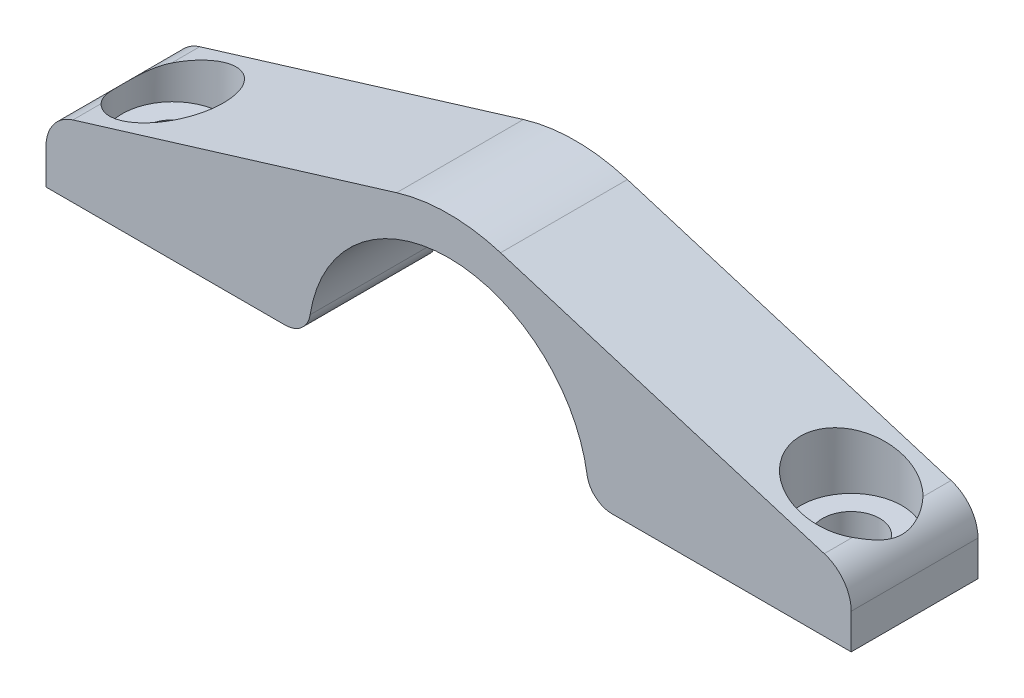
from build123d import *

# Parameters (mm, degrees)
EXTRUDE_1_DEPTH             = 10
HOLE_WIZARD_M43_D           = 4.5
HOLE_WIZARD_M43_CBORE_D     = 8
HOLE_WIZARD_M43_CBORE_DEPTH = 4
FILLET_4_R                  = 2
FILLET_2_R                  = 3


with BuildPart() as part:
    # Эскиз1 → Бобышка-Вытянуть1 (new body)
    with BuildSketch(Plane.XY):
        with BuildLine():
            Line((-31.75, 5), (-4.101162824, 13.438116069))
            ThreePointArc((-4.101162824, 13.438116069), (0, 14.05), (4.101162824, 13.438116069))
            Line((4.101162824, 13.438116069), (31.75, 5))
            Line((31.75, 5), (31.75, 0))
            Line((31.75, 0), (11.05, 0))
            ThreePointArc((11.05, 0), (0, 11.05), (-11.05, 0))
            Line((-11.05, 0), (-31.75, 0))
            Line((-31.75, 0), (-31.75, 5))
        make_face()
    extrude(amount=EXTRUDE_1_DEPTH)

    # Эскиз5 → Цековка для винта с внутренним шестигранником M42 (revolve, cut)
    with BuildSketch(Plane(origin=(-26.75, 7, 5), x_dir=(0, 0, -1), z_dir=(1, 0, 0))):
        Polygon((0, 0), (0, 7.05), (2.25, 7.05), (2.25, 4), (4, 4), (4, 0), align=None)
    revolve(axis=Axis((-26.75, 0.65, 5), (0, 1, 0)), mode=Mode.SUBTRACT)

    # Цековка для винта с внутренним шестигранником M43 (through all)
    with Locations(Plane(origin=(0, 7, 0), x_dir=(1, 0, 0), z_dir=(0, 1, 0))):
        with Locations((-26.75, -5)):
            CounterBoreHole(HOLE_WIZARD_M43_D / 2, HOLE_WIZARD_M43_CBORE_D / 2, HOLE_WIZARD_M43_CBORE_DEPTH)

    # Эскиз10 → Цековка для винта с внутренним шестигранником M44 (revolve, cut)
    with BuildSketch(Plane(origin=(26.75, 7, 5), x_dir=(0, 0, 1), z_dir=(1, 0, 0))):
        Polygon((0, 0), (0, 7), (2.25, 7), (2.25, 4), (4, 4), (4, 0), align=None)
    revolve(axis=Axis((26.75, 13.35, 5), (0, -1, 0)), mode=Mode.SUBTRACT)

    # Эскиз12 → Цековка для винта с внутренним шестигранником M45 (revolve, cut)
    with BuildSketch(Plane(origin=(26.75, 7, 5), x_dir=(0, 0, -1), z_dir=(1, 0, 0))):
        Polygon((0, 0), (0, 7.05), (2.25, 7.05), (2.25, 4), (4, 4), (4, 0), align=None)
    revolve(axis=Axis((26.75, 0.65, 5), (0, 1, 0)), mode=Mode.SUBTRACT)

    # Скругление4
    fillet_4_edges = [part.edges().sort_by_distance(p)[0] for p in [
        (-11.05, 0, 5),
        (11.05, 0, 5),
    ]]
    fillet(fillet_4_edges, radius=FILLET_4_R)

    # Скругление2
    # the kernel refuses this fillet: 3 mm, written as the material it takes off along each edge
    with BuildSketch(Plane(origin=(-31.75, 5, -5.552584785), x_dir=(0, -1, 0), z_dir=(0, 0, 1)), Plane(origin=(31.75, 5, -5.552584785), x_dir=(-0.95644954230243, 0.2918977098736336, 0), z_dir=(0, 0, 1))) as fillet_2_piece_1:
        with BuildLine():
            CenterArc((FILLET_2_R * 0.740344637964, FILLET_2_R), FILLET_2_R, 196.971603354, 73.028396646)
            Line((-FILLET_2_R * 0.216104904339, FILLET_2_R * 0.708102290126), (0, 0))
            Line((0, 0), (FILLET_2_R * 0.740344637964, 0))
        make_face()
    extrude(amount=21.105169569, mode=Mode.SUBTRACT)


solid = part.part
